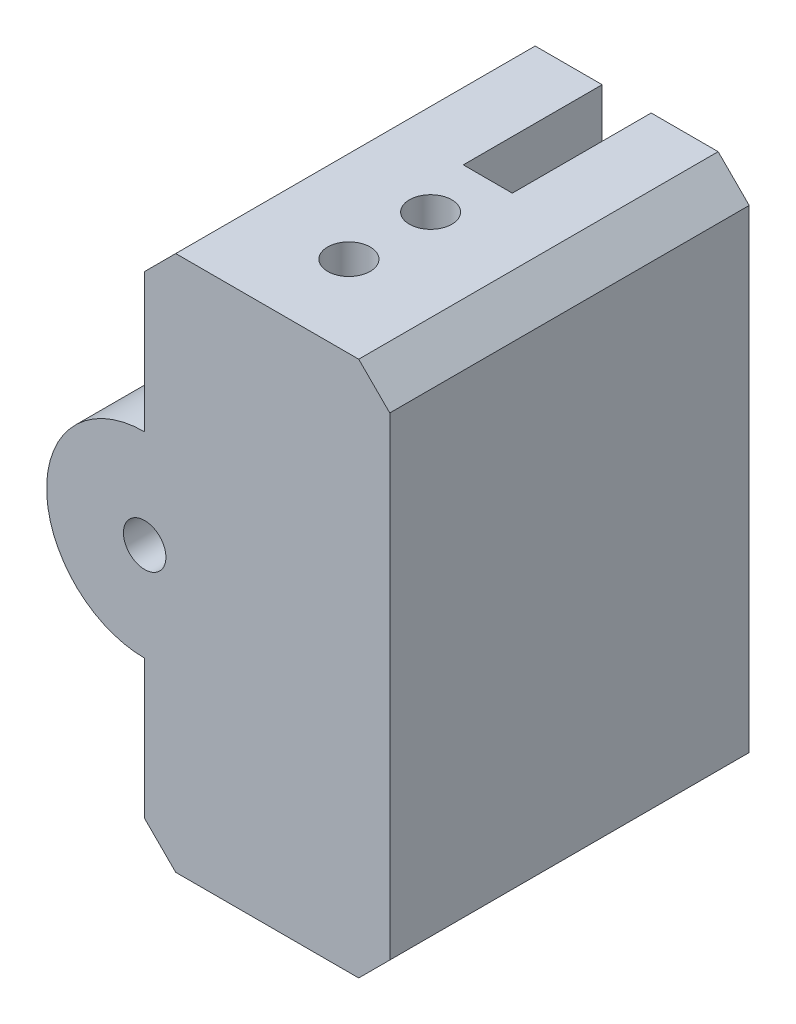
from build123d import *

# Parameters (mm, degrees)
SKETCH1_R               = 1.3
BOSS_EXTRUDE1_DEPTH     = 32.8
CHAMFER1_SIZE           = 1.9
CHAMFER2_SIZE           = 1.9
SKETCH2_R               = 6
BOSS_EXTRUDE2_DEPTH     = 22
CUT_EXTRUDE1_DEPTH      = 42.738351668
CUT_EXTRUDE1_DEPTH_BACK = 42.738351668
SKETCH3_R               = 1.3


with BuildPart() as part:
    # Sketch1 → Boss-Extrude1 (new body)
    with BuildSketch(Plane(origin=(0, 0, 0), x_dir=(1, 0, 0), z_dir=(0, 1, 0))):
        Polygon((-1.5, 0), (-7.5, 0), (-7.5, -22), (7.5, -22), (7.5, 0), (1.5, 0), (1.5, -8.5), (-1.5, -8.5), align=None)
        with Locations((0, -17)):
            Circle(SKETCH1_R, mode=Mode.SUBTRACT)
        with Locations((0, -12)):
            Circle(SKETCH1_R, mode=Mode.SUBTRACT)
    extrude(amount=BOSS_EXTRUDE1_DEPTH)

    # Chamfer1
    chamfer1_edges = [part.edges().sort_by_distance(p)[0] for p in [
        (7.5, 32.8, 11),
        (7.5, 0, 11),
    ]]
    chamfer(chamfer1_edges, length=CHAMFER1_SIZE)

    # Chamfer2
    chamfer2_edges = [part.edges().sort_by_distance(p)[0] for p in [
        (-7.5, 0, 11),
        (-7.5, 32.8, 11),
    ]]
    chamfer(chamfer2_edges, length=CHAMFER2_SIZE)

    # Sketch2 → Boss-Extrude2 (add)
    with BuildSketch(Plane(origin=(0, 0, 0), x_dir=(-1, 0, 0), z_dir=(0, 0, -1))):
        with Locations((7.5, 16.4)):
            Circle(SKETCH2_R)
    extrude(amount=-BOSS_EXTRUDE2_DEPTH)

    # Sketch3 → Cut-Extrude1 (cut, two sides: drawn at the far end of the back side and taken through both)
    with BuildSketch(Plane(origin=(0, 0, 0), x_dir=(-1, 0, 0), z_dir=(0, 0, -1)).offset(-CUT_EXTRUDE1_DEPTH_BACK)):
        with Locations((7.5, 16.4)):
            Circle(SKETCH3_R)
    extrude(amount=CUT_EXTRUDE1_DEPTH + CUT_EXTRUDE1_DEPTH_BACK, mode=Mode.SUBTRACT)


solid = part.part
